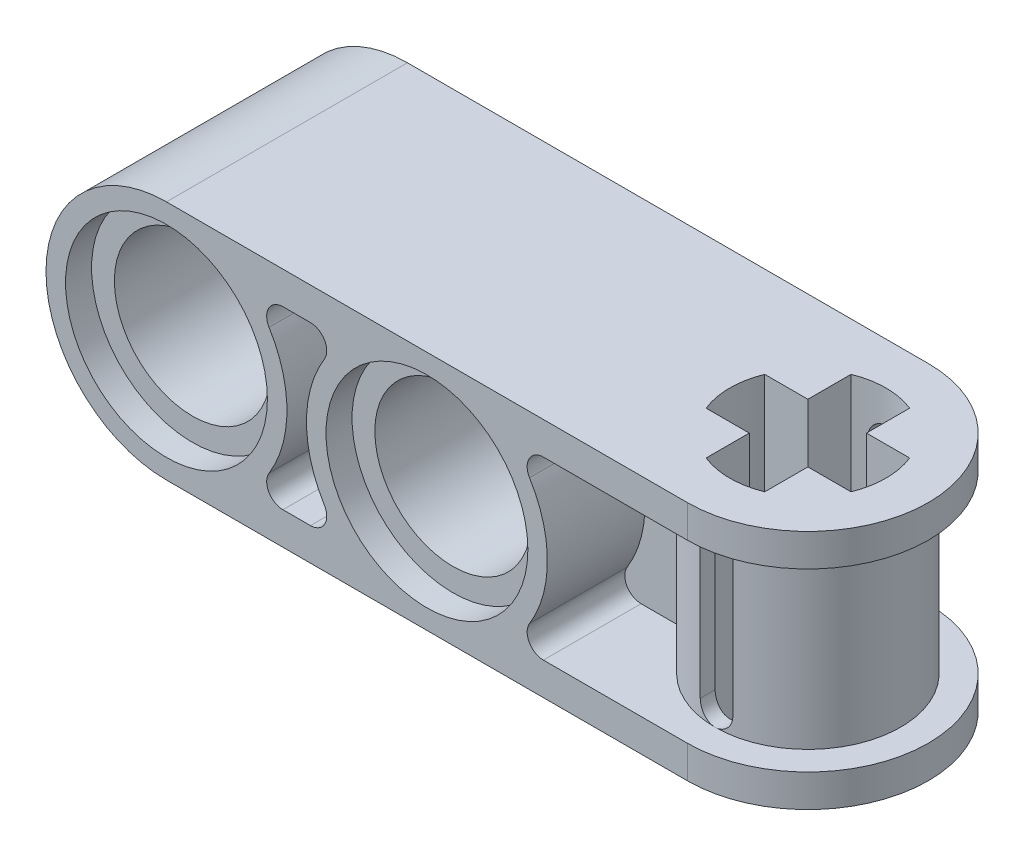
from build123d import *

# Parameters (mm, degrees)
SKETCH1_R                  = 3.7
SKETCH1_R_2                = 2.4
PIN_SIDE_DEPTH             = 3.7
SIDE_START                 = 3.7
SIDE_EAR_DEPTH             = 1
MIDDLE_RIB_DEPTH           = 0.7
SKETCH4_R                  = 2.85
AXLE_BODY_DEPTH            = 3.7
AXLE_CUT_DEPTH             = 21.383081219
AXLE_CUT_DEPTH_BACK        = 21.383081219
SKETCH5_W                  = 1.8
SKETCH5_H                  = 1.8
AXLE_SLOT_DEPTH            = 21.383081219
AXLE_SLOT_DEPTH_BACK       = 21.383081219
SKETCH8_R                  = 3.7
SKETCH8_R_2                = 2.4
SECOND_PIN_BODY_DEPTH      = 3.7
SECOND_PIN_HOLE_DEPTH      = 21.383081238
SECOND_PIN_HOLE_DEPTH_BACK = 21.383081238
SKETCH9_R                  = 2.4
SKETCH7_R                  = 3.1
PIN_RIM_DEPTH              = 0.8
FILLET1_R                  = 0.5
MIRROR2_START              = -3.7
MIRROR2_OUTLINE_R          = 3.1
MIRROR2_OUTLINE_R_2        = 2.4
MIRROR2_DEPTH              = 0.8
MIRROR2_2_DEPTH            = 3
MIRROR2_START_2            = 0.7
MIRROR2_3_DEPTH            = 3


# Read off the part's stored shape, not the designer's step: Mirror2
with BuildPart() as part:
    # Sketch1 → Pin Side (new, symmetric)
    with BuildSketch(Plane.XY):
        Circle(SKETCH1_R)
        Circle(SKETCH1_R_2, mode=Mode.SUBTRACT)
    extrude(amount=PIN_SIDE_DEPTH, both=True)

    # Sketch2 → Side Ear (add)
    with BuildSketch(Plane(origin=(0, 0, 0), x_dir=(1, 0, 0), z_dir=(0, 1, 0)).offset(SIDE_START)):
        with BuildLine():
            Line((0, 3.7), (0, -3.7))
            Line((0, -3.7), (16, -3.7))
            ThreePointArc((16, -3.7), (19.7, 0), (16, 3.7))
            Line((16, 3.7), (0, 3.7))
        make_face()
    side_ear = extrude(amount=-SIDE_EAR_DEPTH)

    # Mirror1: Side Ear across plane
    add(side_ear.mirror(Plane.ZX))

    # Sketch3 → Middle Rib (add, symmetric)
    with BuildSketch(Plane.XY):
        with BuildLine():
            Line((2.529822128, -2.7), (16, -2.7))
            Line((16, -2.7), (16, 2.7))
            Line((16, 2.7), (2.529822128, 2.7))
            ThreePointArc((2.529822128, 2.7), (3.7, 0), (2.529822128, -2.7))
        make_face()
    extrude(amount=MIDDLE_RIB_DEPTH, both=True)

    # Sketch4 → Axle Body (add, symmetric)
    with BuildSketch(Plane(origin=(0, 0, 0), x_dir=(1, 0, 0), z_dir=(0, 1, 0))):
        with Locations((16, 0)):
            Circle(SKETCH4_R)
    extrude(amount=AXLE_BODY_DEPTH, both=True)

    # Sketch5 → Axle Cut (cut, two sides: drawn at the far end of the back side and taken through both)
    with BuildSketch(Plane(origin=(0, 0, 0), x_dir=(1, 0, 0), z_dir=(0, 1, 0)).offset(-AXLE_CUT_DEPTH_BACK)):
        with BuildLine():
            Line((13.775140454, -0.9), (15.1, -0.9))
            Line((15.1, -0.9), (15.1, 0.9))
            Line((15.1, 0.9), (13.775140454, 0.9))
            ThreePointArc((13.775140454, 0.9), (13.644191974, 0.45844143), (13.6, 0))
            ThreePointArc((13.6, 0), (13.644191974, -0.45844143), (13.775140454, -0.9))
        make_face()
        with BuildLine():
            Line((15.1, 0.9), (16.9, 0.9))
            Line((16.9, 0.9), (16.9, 2.224859546))
            ThreePointArc((16.9, 2.224859546), (16.45844143, 2.355808026), (16, 2.4))
            ThreePointArc((16, 2.4), (15.54155857, 2.355808026), (15.1, 2.224859546))
            Line((15.1, 2.224859546), (15.1, 0.9))
        make_face()
        with Locations((16, 0)):
            Rectangle(SKETCH5_W, SKETCH5_H)
        with BuildLine():
            Line((16.9, 0.9), (16.9, -0.9))
            Line((16.9, -0.9), (18.224859546, -0.9))
            ThreePointArc((18.224859546, -0.9), (18.355808026, -0.45844143), (18.4, 0))
            ThreePointArc((18.4, 0), (18.355808026, 0.45844143), (18.224859546, 0.9))
            Line((18.224859546, 0.9), (16.9, 0.9))
        make_face()
        with BuildLine():
            ThreePointArc((15.1, -2.224859546), (15.54155857, -2.355808026), (16, -2.4))
            ThreePointArc((16, -2.4), (16.45844143, -2.355808026), (16.9, -2.224859546))
            Line((16.9, -2.224859546), (16.9, -0.9))
            Line((16.9, -0.9), (15.1, -0.9))
            Line((15.1, -0.9), (15.1, -2.224859546))
        make_face()
    extrude(amount=AXLE_CUT_DEPTH + AXLE_CUT_DEPTH_BACK, mode=Mode.SUBTRACT)

    # Sketch6 → Axle Slot (cut, two sides: drawn at the far end of the back side and taken through both)
    with BuildSketch(Plane.XY.offset(-AXLE_SLOT_DEPTH_BACK)):
        with BuildLine():
            Line((15.5, -2.2), (15.5, 2.2))
            ThreePointArc((15.5, 2.2), (16, 2.7), (16.5, 2.2))
            Line((16.5, 2.2), (16.5, -2.2))
            ThreePointArc((16.5, -2.2), (16, -2.7), (15.5, -2.2))
        make_face()
    extrude(amount=AXLE_SLOT_DEPTH + AXLE_SLOT_DEPTH_BACK, mode=Mode.SUBTRACT)

    # Sketch8 → Second Pin Body (add, symmetric)
    with BuildSketch(Plane.XY):
        with Locations((8, 0)):
            Circle(SKETCH8_R)
        with Locations((8, 0)):
            Circle(SKETCH8_R_2, mode=Mode.SUBTRACT)
    extrude(amount=SECOND_PIN_BODY_DEPTH, both=True)

    # Sketch9 → Second Pin Hole (cut, two sides: drawn at the far end of the back side and taken through both)
    with BuildSketch(Plane.XY.offset(-SECOND_PIN_HOLE_DEPTH_BACK)):
        with Locations((8, 0)):
            Circle(SKETCH9_R)
    extrude(amount=SECOND_PIN_HOLE_DEPTH + SECOND_PIN_HOLE_DEPTH_BACK, mode=Mode.SUBTRACT)

    # Sketch7 → Pin Rim (cut)
    with BuildSketch(Plane.XY.offset(3.7)):
        Circle(SKETCH7_R)
        with Locations((8, 0)):
            Circle(SKETCH7_R)
    extrude(amount=-PIN_RIM_DEPTH, mode=Mode.SUBTRACT)

    # Fillet1
    fillet1_edges = [part.edges().sort_by_distance(p)[0] for p in [
        (5.470177872, -2.7, 2.2),
        (5.470177872, 2.7, 2.2),
        (2.529822128, -2.7, 2.2),
        (2.529822128, 2.7, 2.2),
    ]]
    fillet(fillet1_edges, radius=FILLET1_R)

    # Mirror2 outline → Mirror2 (cut)
    # profile 1 of 2: a face of its own
    with BuildSketch(Plane.XY.offset(MIRROR2_START)):
        with Locations((8, 0)):
            Circle(MIRROR2_OUTLINE_R)
        with Locations((8, 0)):
            Circle(MIRROR2_OUTLINE_R_2, mode=Mode.SUBTRACT)
    # profile 2 of 2: a face of its own
    with BuildSketch(Plane.XY.offset(MIRROR2_START)):
        Circle(MIRROR2_OUTLINE_R)
        Circle(MIRROR2_OUTLINE_R_2, mode=Mode.SUBTRACT)
    extrude(amount=MIRROR2_DEPTH, mode=Mode.SUBTRACT)

    # Mirror2 2 outline → Mirror2 2 (add)
    with BuildSketch(Plane.XY.offset(MIRROR2_START)):
        with BuildLine():
            ThreePointArc((2.529822128, 2.7), (2.86623565, 2.33980623), (3.151791054, 1.938095238))
            ThreePointArc((3.151791054, 1.938095238), (3.141272984, 2.443975018), (3.577708764, 2.7))
            Line((3.577708764, 2.7), (2.529822128, 2.7))
        make_face()
        with BuildLine():
            ThreePointArc((3.577708764, -2.7), (3.141272984, -2.443975018), (3.151791054, -1.938095238))
            ThreePointArc((3.151791054, -1.938095238), (2.86623565, -2.33980623), (2.529822128, -2.7))
            Line((2.529822128, -2.7), (3.577708764, -2.7))
        make_face()
    extrude(amount=MIRROR2_2_DEPTH)

    # Mirror2 3 outline → Mirror2 3 (add)
    with BuildSketch(Plane.XY.offset(MIRROR2_START_2)):
        with BuildLine():
            ThreePointArc((10.529822128, 2.7), (10.86623565, 2.33980623), (11.151791054, 1.938095238))
            ThreePointArc((11.151791054, 1.938095238), (11.141272984, 2.443975018), (11.577708764, 2.7))
            Line((11.577708764, 2.7), (10.529822128, 2.7))
        make_face()
        with BuildLine():
            ThreePointArc((11.577708764, -2.7), (11.141272984, -2.443975018), (11.151791054, -1.938095238))
            ThreePointArc((11.151791054, -1.938095238), (10.86623565, -2.33980623), (10.529822128, -2.7))
            Line((10.529822128, -2.7), (11.577708764, -2.7))
        make_face()
    extrude(amount=MIRROR2_3_DEPTH)


solid = part.part
